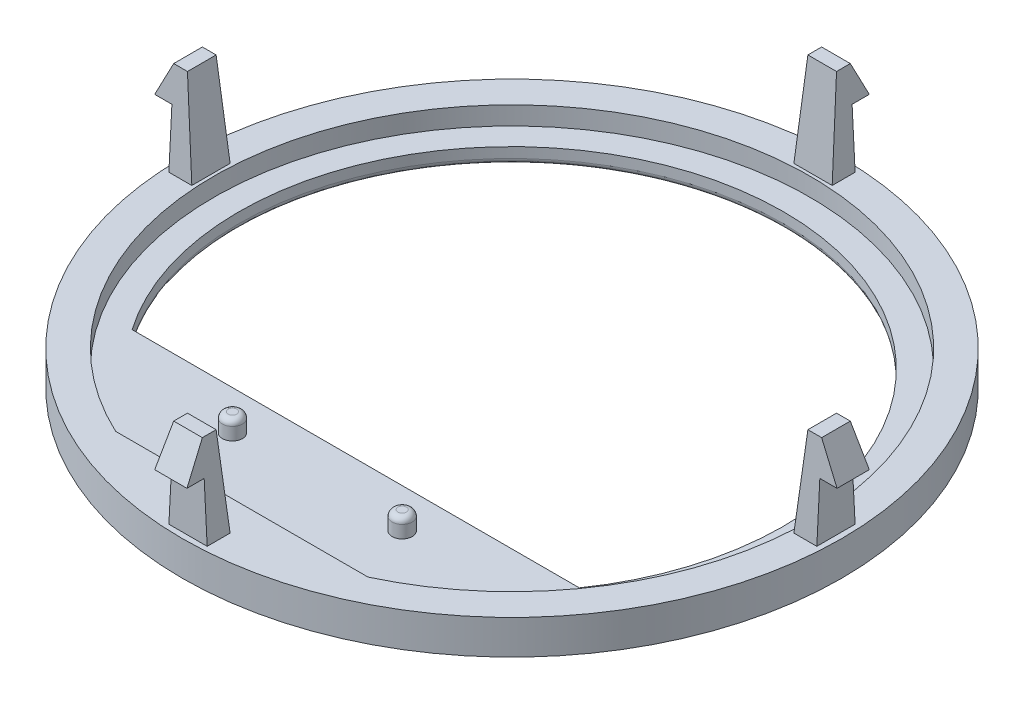
from build123d import *

# Parameters (mm, degrees)
SKETCH1_R           = 14.605
BOSS_EXTRUDE1_DEPTH = 1.524
CUT_EXTRUDE1_DEPTH  = 0.8128
SKETCH4_R           = 0.4445
BOSS_EXTRUDE2_DEPTH = 0.8128
CUT_EXTRUDE2_DEPTH  = 21.670575557
FILLET1_R           = 0.254
FILLET3_R           = 0.254
SNAP_START          = 13.7414
SNAP_HOOK1_DEPTH    = 0.6096
SNAP_START_2        = -0.714869456
SNAP_HOOK1_2_DEPTH  = 1.429738912
SNAP_START_3        = -0.847985215
SNAP_HOOK1_3_DEPTH  = 1.69597043
SNAP_START_4        = 12
SNAP_HOOK1_4_DEPTH  = 4
CIRPATTERN1_COUNT   = 4


with BuildPart() as part:
    # Sketch1 → Boss-Extrude1 (new body)
    with BuildSketch(Plane(origin=(0, 0, 0), x_dir=(1, 0, 0), z_dir=(0, 1, 0))):
        with Locations(Location((0, 0, 0), (0, 0, 270))):
            Circle(SKETCH1_R)
    extrude(amount=BOSS_EXTRUDE1_DEPTH)

    # Sketch3 → Cut-Extrude1 (cut)
    with BuildSketch(Plane(origin=(0, 1.524, 0), x_dir=(1, 0, 0), z_dir=(0, 1, 0))):
        with BuildLine():
            Line((-5.588, -11.967686493), (5.588, -11.967686493))
            ThreePointArc((5.588, -11.967686493), (0, 13.208), (-5.588, -11.967686493))
        make_face()
    extrude(amount=-CUT_EXTRUDE1_DEPTH, mode=Mode.SUBTRACT)

    # Sketch4 → Boss-Extrude2 (add)
    with BuildSketch(Plane(origin=(0, 0.7112, 0), x_dir=(1, 0, 0), z_dir=(0, 1, 0))):
        with Locations(Location((-3.7592, -8.6233, 0), (0, 0, 90))):
            Circle(SKETCH4_R)
        with Locations(Location((3.7592, -8.6233, 0), (0, 0, 90))):
            Circle(SKETCH4_R)
    extrude(amount=BOSS_EXTRUDE2_DEPTH)

    # Sketch5 → Cut-Extrude2 (cut, through all)
    with BuildSketch(Plane(origin=(0, 0.7112, 0), x_dir=(1, 0, 0), z_dir=(0, 1, 0))):
        with BuildLine():
            Line((-9.940854815, -6.887686493), (9.870656967, -6.887686493))
            ThreePointArc((9.870656967, -6.887686493), (-0.035098924, 12.065), (-9.940854815, -6.887686493))
        make_face()
    extrude(amount=-CUT_EXTRUDE2_DEPTH, mode=Mode.SUBTRACT)

    # Fillet1
    fillet1_edges = [part.edges().sort_by_distance(p)[0] for p in [
        (-0.035098924, 0, -12.065),
        (-0.035098924, 0, 6.887686493),
    ]]
    fillet(fillet1_edges, radius=FILLET1_R)

    # Fillet3
    fillet3_edges = [part.edges().sort_by_distance(p)[0] for p in [
        (-3.7592, 1.524, 9.0678),
        (3.7592, 1.524, 9.0678),
    ]]
    fillet(fillet3_edges, radius=FILLET3_R)

    # Snap Hook1: read off the stored shape, not the designer's step
    # Snap Hook1 outline → Snap Hook1 (add)
    with BuildSketch(Plane.XY.offset(SNAP_START)):
        Polygon((-0.847985215, 1.524), (0.847985215, 1.524), (0.635, 5.588), (-0.635, 5.588), align=None)
    snap_hook1 = extrude(amount=SNAP_HOOK1_DEPTH)

    # Snap Hook1 2 outline → Snap Hook1 2 (add)
    with BuildSketch(Plane.YZ.offset(SNAP_START_2)):
        Polygon((1.524, 13.7414), (1.524, 13.335), (5.588, 13.7414), align=None)
        Polygon((4.064, 15.113), (4.064, 14.351), (5.588, 14.351), align=None)
    snap_hook1_2 = extrude(amount=SNAP_HOOK1_2_DEPTH)

    # Snap Hook1 3 outline → Snap Hook1 3 (add)
    with BuildSketch(Plane.YZ.offset(SNAP_START_3)):
        Polygon((1.524, 13.7414), (1.524, 13.335), (5.588, 13.7414), align=None)
    snap_hook1_3 = extrude(amount=SNAP_HOOK1_3_DEPTH)

    # Snap Hook1 4 outline → Snap Hook1 4 (cut)
    with BuildSketch(Plane.XY.offset(SNAP_START_4)):
        Polygon((0.847985215, 1.524), (0.847985215, 7), (0.561000216, 7), (0.635, 5.588), align=None)
        Polygon((-0.635, 5.588), (-0.561000216, 7), (-0.847985215, 7), (-0.847985215, 1.524), align=None)
    snap_hook1_4 = extrude(amount=SNAP_HOOK1_4_DEPTH, mode=Mode.SUBTRACT)

    # CirPattern1: Snap Hook1, Snap Hook1 2, Snap Hook1 3, Snap Hook1 4 ×4 about axis
    cirpattern1_axis = Axis((0, 1.524, 0), (0, 1, 0))
    add([snap_hook1.rotate(cirpattern1_axis, i * 360 / CIRPATTERN1_COUNT) for i in range(1, CIRPATTERN1_COUNT)])
    add([snap_hook1_2.rotate(cirpattern1_axis, i * 360 / CIRPATTERN1_COUNT) for i in range(1, CIRPATTERN1_COUNT)])
    add([snap_hook1_3.rotate(cirpattern1_axis, i * 360 / CIRPATTERN1_COUNT) for i in range(1, CIRPATTERN1_COUNT)])
    add([snap_hook1_4.rotate(cirpattern1_axis, i * 360 / CIRPATTERN1_COUNT) for i in range(1, CIRPATTERN1_COUNT)], mode=Mode.SUBTRACT)


solid = part.part
